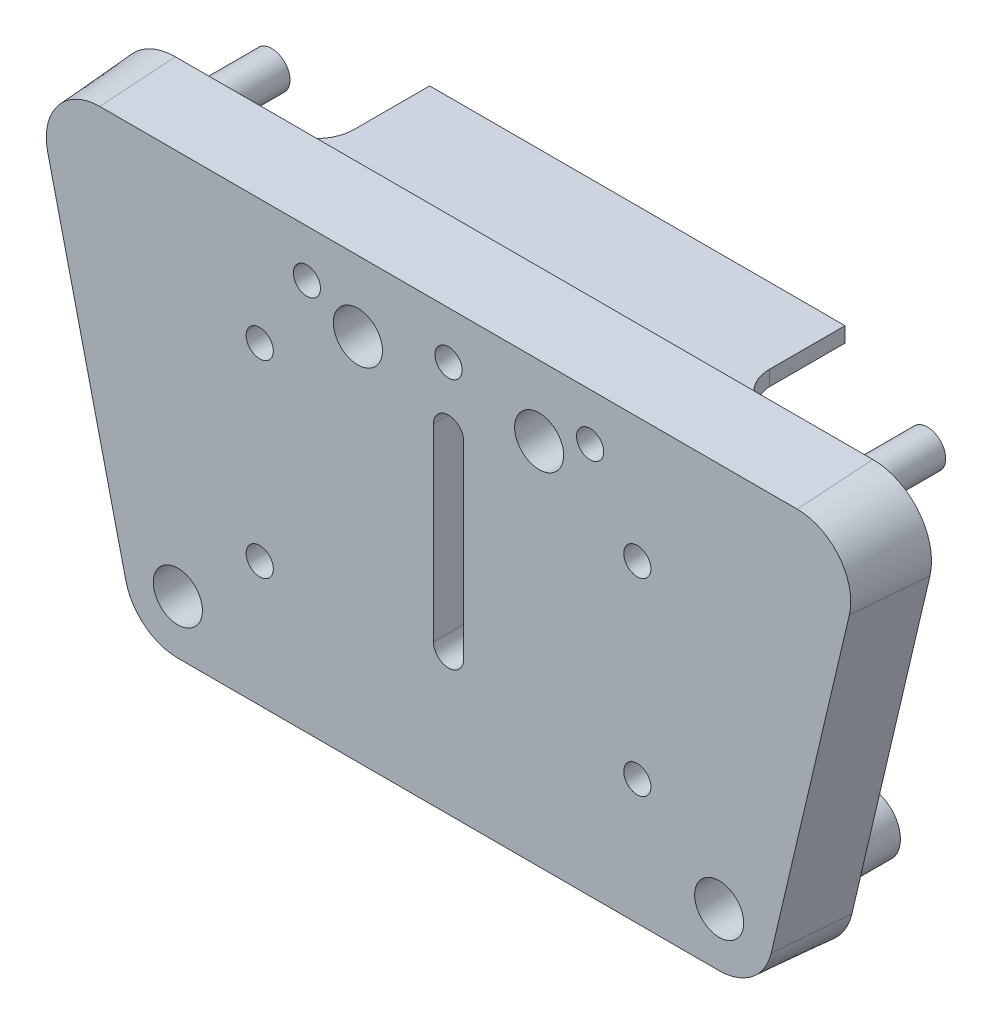
from build123d import *

# Parameters (mm, degrees)
BOSS_EXTRUDE2_DEPTH              = 10
FILLET1_R                        = 7.777777778
SKETCH11_R                       = 2.425
SKETCH11_R_2                     = 4
BOSS_EXTRUDE3_DEPTH              = 10
CHAMFER1_SIZE                    = 0.699268119
CHAMFER1_SIZE_2                  = 10
SKETCH11_4_R                     = 3.5
SKETCH11_4_R_2                   = 2.425
BOSS_EXTRUDE4_DEPTH              = 1.5
CBORE_FOR_M3_SHCS2_D             = 3.6
CBORE_FOR_M3_SHCS2_CBORE_D       = 6.5
CBORE_FOR_M3_SHCS2_CBORE_DEPTH   = 8
CUT_EXTRUDE4_DEPTH               = 81.942358333
SKETCH31_W                       = 55
SKETCH31_H                       = 2
BOSS_EXTRUDE5_DEPTH              = 15
FILLET2_R                        = 5
CBORE_FOR_M3_SHCS3_OUTLINE_R     = 1.8
CBORE_FOR_M3_SHCS3_DEPTH         = 10
CBORE_FOR_M3_SHCS3_2_OUTLINE_R   = 3.25
CBORE_FOR_M3_SHCS3_2_OUTLINE_R_2 = 1.8
CBORE_FOR_M3_SHCS3_2_DEPTH       = 3
M3_CLEARANCE_HOLE4_D             = 3.6
SKETCH43_R                       = 4
BOSS_EXTRUDE6_DEPTH              = 10
CBORE_START                      = 2
CBORE_FOR_M3_SHCS4_OUTLINE_R     = 3.25
CBORE_FOR_M3_SHCS4_DEPTH         = 8
CBORE_START_2                    = -10
CBORE_FOR_M3_SHCS4_2_OUTLINE_R   = 1.8
CBORE_FOR_M3_SHCS4_2_DEPTH       = 12


# Read off the part's stored shape, not the designer's step: CBORE for M3 SHCS3, CBORE for M3 SHCS4
with BuildPart() as part:
    # Sketch9 → Boss-Extrude2 (new body)
    with BuildSketch(Plane.XY):
        Polygon((0, 0), (0, 59.5), (-56, 59.5), (-42, 0), align=None)
    boss_extrude2 = extrude(amount=BOSS_EXTRUDE2_DEPTH)

    # Mirror2: Boss-Extrude2 across plane
    add(boss_extrude2.mirror(Plane(origin=(0, 0, 10), x_dir=(0, 0, 1), z_dir=(-1, 0, 0))))

    # Fillet1
    fillet1_edges = [part.edges().sort_by_distance(p)[0] for p in [
        (42, 0, 5),
        (56, 59.5, 5),
        (-42, 0, 5),
        (-56, 59.5, 5),
    ]]
    fillet(fillet1_edges, radius=FILLET1_R)

    # Sketch11 → Boss-Extrude3 (add)
    with BuildSketch(Plane(origin=(0, 0, 0), x_dir=(-1, 0, 0), z_dir=(0, 0, -1))):
        with Locations(Location((-43.410908409, 54.412250943, 0), (0, 0, 180))):
            Circle(SKETCH11_R)
        with Locations(Location((-35.839885988, 7.777777778, 0), (0, 0, 180))):
            Circle(SKETCH11_R_2)
    boss_extrude3 = extrude(amount=BOSS_EXTRUDE3_DEPTH)

    # Chamfer1
    # the kernel refuses this chamfer: 10, 0.699268119 mm, written as the material it takes off along each edge
    with BuildSketch(Plane(origin=(-35.839885988, 0, 10), x_dir=(0, 0.8766829747338895, 0.48106856248536783), z_dir=(1, 0, 0))) as chamfer1_piece_1:
        Polygon((CHAMFER1_SIZE * 0.876682975279, -CHAMFER1_SIZE * 0.481068562785), (-CHAMFER1_SIZE_2 * 0.481068562485, -CHAMFER1_SIZE_2 * 0.876682974734), (0, 0), align=None)
    extrude(amount=71.679771977, mode=Mode.SUBTRACT)
    with BuildSketch(Plane(origin=(35.839885988, 7.777777778, 10), x_dir=(0, -1, 0), z_dir=(-1, 0, 0))) as chamfer1_piece_2:
        Polygon((7.777777778 - CHAMFER1_SIZE, 0), (7.777777778, -CHAMFER1_SIZE_2), (7.777777778, 0), align=None)
    revolve(axis=Axis((35.839885988, 7.777777778, 10), (0, 0, 1)), revolution_arc=76.759480085, mode=Mode.SUBTRACT)
    with BuildSketch(Plane(origin=(-35.839885988, 7.777777778, 10), x_dir=(0, -1, 0), z_dir=(1, 0, 0))) as chamfer1_piece_3:
        Polygon((7.777777778 - CHAMFER1_SIZE, 0), (7.777777778, CHAMFER1_SIZE_2), (7.777777778, 0), align=None)
    revolve(axis=Axis((-35.839885988, 7.777777778, 10), (0, 0, -1)), revolution_arc=76.759480085, mode=Mode.SUBTRACT)
    with BuildSketch(Plane(origin=(53.75077769, 49.940805182, 10), x_dir=(-0.8533782587917171, 0.2007948844215805, 0.4810685624853707), z_dir=(-0.2290393337255473, -0.973417168333576, 0))) as chamfer1_piece_4:
        Polygon((CHAMFER1_SIZE * 0.876682975279, CHAMFER1_SIZE * 0.481068562785), (-CHAMFER1_SIZE_2 * 0.481068562485, CHAMFER1_SIZE_2 * 0.876682974734), (0, 0), align=None)
    extrude(amount=45.144513446, mode=Mode.SUBTRACT)
    with BuildSketch(Plane(origin=(-53.75077769, 49.940805182, 10), x_dir=(0.8533782587917171, 0.2007948844215805, 0.4810685624853707), z_dir=(0.2290393337255473, -0.973417168333576, 0))) as chamfer1_piece_5:
        Polygon((CHAMFER1_SIZE * 0.876682975279, -CHAMFER1_SIZE * 0.481068562785), (-CHAMFER1_SIZE_2 * 0.481068562485, -CHAMFER1_SIZE_2 * 0.876682974734), (0, 0), align=None)
    extrude(amount=45.144513446, mode=Mode.SUBTRACT)
    with BuildSketch(Plane(origin=(46.17975527, 51.722222222, 10), x_dir=(0, 1, 0), z_dir=(-1, 0, 0))) as chamfer1_piece_6:
        Polygon((7.777777778, CHAMFER1_SIZE_2), (7.777777778 - CHAMFER1_SIZE, 0), (7.777777778, 0), align=None)
    revolve(axis=Axis((46.17975527, 51.722222222, 10), (0, 0, -1)), revolution_arc=103.240519915, mode=Mode.SUBTRACT)
    with BuildSketch(Plane(origin=(-46.17975527, 51.722222222, 10), x_dir=(0, 1, 0), z_dir=(1, 0, 0))) as chamfer1_piece_7:
        Polygon((7.777777778, -CHAMFER1_SIZE_2), (7.777777778 - CHAMFER1_SIZE, 0), (7.777777778, 0), align=None)
    revolve(axis=Axis((-46.17975527, 51.722222222, 10), (0, 0, 1)), revolution_arc=103.240519915, mode=Mode.SUBTRACT)
    with BuildSketch(Plane(origin=(-46.17975527, 59.5, 10), x_dir=(0, 0.0026831830283774233, -0.9999964002579389), z_dir=(1, 0, 0))) as chamfer1_piece_8:
        Polygon((CHAMFER1_SIZE_2 * 0.999996400258, -CHAMFER1_SIZE_2 * 0.00268318302838), (-CHAMFER1_SIZE * 0.00268318303005, -CHAMFER1_SIZE * 0.99999640088), (0, 0), align=None)
    extrude(amount=92.359510539, mode=Mode.SUBTRACT)

    # Sketch11<4> → Boss-Extrude4 (add)
    with BuildSketch(Plane(origin=(0, 0, 0), x_dir=(-1, 0, 0), z_dir=(0, 0, -1))):
        with Locations(Location((-43.410908409, 54.412250943, 0), (0, 0, 180))):
            Circle(SKETCH11_4_R)
        with Locations((-43.410908409, 54.412250943)):
            Circle(SKETCH11_4_R_2, mode=Mode.SUBTRACT)
    boss_extrude4 = extrude(amount=BOSS_EXTRUDE4_DEPTH)

    # Mirror3: Boss-Extrude3, Boss-Extrude4 across plane
    add(boss_extrude3.mirror(Plane(origin=(0, 0, 0), x_dir=(0, 0, 1), z_dir=(1, 0, 0))))
    add(boss_extrude4.mirror(Plane(origin=(0, 0, 0), x_dir=(0, 0, 1), z_dir=(1, 0, 0))))

    # CBORE for M3 SHCS2 (through all)
    with Locations(Plane.XY.offset(10)):
        with Locations((35.839885988, 7.777777778)):
            cbore_for_m3_shcs2 = CounterBoreHole(CBORE_FOR_M3_SHCS2_D / 2, CBORE_FOR_M3_SHCS2_CBORE_D / 2, CBORE_FOR_M3_SHCS2_CBORE_DEPTH)

    # Mirror4: CBORE for M3 SHCS2 across plane
    add(cbore_for_m3_shcs2.mirror(Plane(origin=(0, 0, 0), x_dir=(0, 0, 1), z_dir=(1, 0, 0))), mode=Mode.SUBTRACT)

    # Sketch30 → Cut-Extrude4 (cut, through all)
    with BuildSketch(Plane(origin=(0, 0, 0), x_dir=(-1, 0, 0), z_dir=(0, 0, -1))):
        with BuildLine():
            Line((2, 44.5), (2, 19.5))
            ThreePointArc((2, 19.5), (0, 17.5), (-2, 19.5))
            Line((-2, 19.5), (-2, 44.5))
            ThreePointArc((-2, 44.5), (0, 46.5), (2, 44.5))
        make_face()
    extrude(amount=-CUT_EXTRUDE4_DEPTH, mode=Mode.SUBTRACT)

    # Sketch31 → Boss-Extrude5 (add)
    with BuildSketch(Plane(origin=(0, 0, 0), x_dir=(-1, 0, 0), z_dir=(0, 0, -1))):
        with Locations((0, 57)):
            Rectangle(SKETCH31_W, SKETCH31_H)
    extrude(amount=BOSS_EXTRUDE5_DEPTH)

    # Fillet2
    fillet2_edges = [part.edges().sort_by_distance(p)[0] for p in [
        (-27.5, 57, 0),
        (27.5, 57, 0),
        (0, 56, 0),
    ]]
    fillet(fillet2_edges, radius=FILLET2_R)

    # CBORE for M3 SHCS3 outline → CBORE for M3 SHCS3 (cut)
    with BuildSketch(Plane.XY):
        with Locations((25, 17.25)):
            Circle(CBORE_FOR_M3_SHCS3_OUTLINE_R)
        with Locations((-25, 17.25)):
            Circle(CBORE_FOR_M3_SHCS3_OUTLINE_R)
        with Locations((-25, 42.25)):
            Circle(CBORE_FOR_M3_SHCS3_OUTLINE_R)
        with Locations((25, 42.25)):
            Circle(CBORE_FOR_M3_SHCS3_OUTLINE_R)
    extrude(amount=CBORE_FOR_M3_SHCS3_DEPTH, mode=Mode.SUBTRACT)

    # CBORE for M3 SHCS3 2 outline → CBORE for M3 SHCS3 2 (cut)
    # profile 1 of 4: a face of its own
    with BuildSketch(Plane.XY):
        with Locations((25, 17.25)):
            Circle(CBORE_FOR_M3_SHCS3_2_OUTLINE_R)
        with Locations((25, 17.25)):
            Circle(CBORE_FOR_M3_SHCS3_2_OUTLINE_R_2, mode=Mode.SUBTRACT)
    # profile 2 of 4: a face of its own
    with BuildSketch(Plane.XY):
        with Locations((-25, 17.25)):
            Circle(CBORE_FOR_M3_SHCS3_2_OUTLINE_R)
        with Locations((-25, 17.25)):
            Circle(CBORE_FOR_M3_SHCS3_2_OUTLINE_R_2, mode=Mode.SUBTRACT)
    # profile 3 of 4: a face of its own
    with BuildSketch(Plane.XY):
        with Locations((-25, 42.25)):
            Circle(CBORE_FOR_M3_SHCS3_2_OUTLINE_R)
        with Locations((-25, 42.25)):
            Circle(CBORE_FOR_M3_SHCS3_2_OUTLINE_R_2, mode=Mode.SUBTRACT)
    # profile 4 of 4: a face of its own
    with BuildSketch(Plane.XY):
        with Locations((25, 42.25)):
            Circle(CBORE_FOR_M3_SHCS3_2_OUTLINE_R)
        with Locations((25, 42.25)):
            Circle(CBORE_FOR_M3_SHCS3_2_OUTLINE_R_2, mode=Mode.SUBTRACT)
    extrude(amount=CBORE_FOR_M3_SHCS3_2_DEPTH, mode=Mode.SUBTRACT)

    # M3 Clearance Hole4 (through all)
    with Locations(Plane.XY.offset(10)):
        with Locations((-18.75, 52.54589051), (0, 52.54589051), (18.75, 52.54589051)):
            Hole(M3_CLEARANCE_HOLE4_D / 2)

    # Sketch43 → Boss-Extrude6 (add)
    with BuildSketch(Plane(origin=(0, 0, 0), x_dir=(-1, 0, 0), z_dir=(0, 0, -1))):
        with BuildLine():
            ThreePointArc((8.291900756, 51), (11.23593095, 45.57365329), (16, 49.5))
            ThreePointArc((16, 49.5), (15.92634671, 50.26406905), (15.708099244, 51))
            Line((15.708099244, 51), (8.291900756, 51))
        make_face()
        with BuildLine():
            Line((8.291900756, 51), (15.708099244, 51))
            ThreePointArc((15.708099244, 51), (12, 53.5), (8.291900756, 51))
        make_face()
        with Locations(Location((-12, 49.5, 0), (0, 0, 157.975687163))):
            Circle(SKETCH43_R)
    extrude(amount=BOSS_EXTRUDE6_DEPTH)

    # CBORE for M3 SHCS4 outline → CBORE for M3 SHCS4 (cut)
    with BuildSketch(Plane.XY.offset(CBORE_START)):
        with Locations((-12, 49.5)):
            Circle(CBORE_FOR_M3_SHCS4_OUTLINE_R)
        with Locations((12, 49.5)):
            Circle(CBORE_FOR_M3_SHCS4_OUTLINE_R)
    extrude(amount=CBORE_FOR_M3_SHCS4_DEPTH, mode=Mode.SUBTRACT)

    # CBORE for M3 SHCS4 2 outline → CBORE for M3 SHCS4 2 (cut)
    with BuildSketch(Plane.XY.offset(CBORE_START_2)):
        with Locations((-12, 49.5)):
            Circle(CBORE_FOR_M3_SHCS4_2_OUTLINE_R)
        with Locations((12, 49.5)):
            Circle(CBORE_FOR_M3_SHCS4_2_OUTLINE_R)
    extrude(amount=CBORE_FOR_M3_SHCS4_2_DEPTH, mode=Mode.SUBTRACT)


solid = part.part
